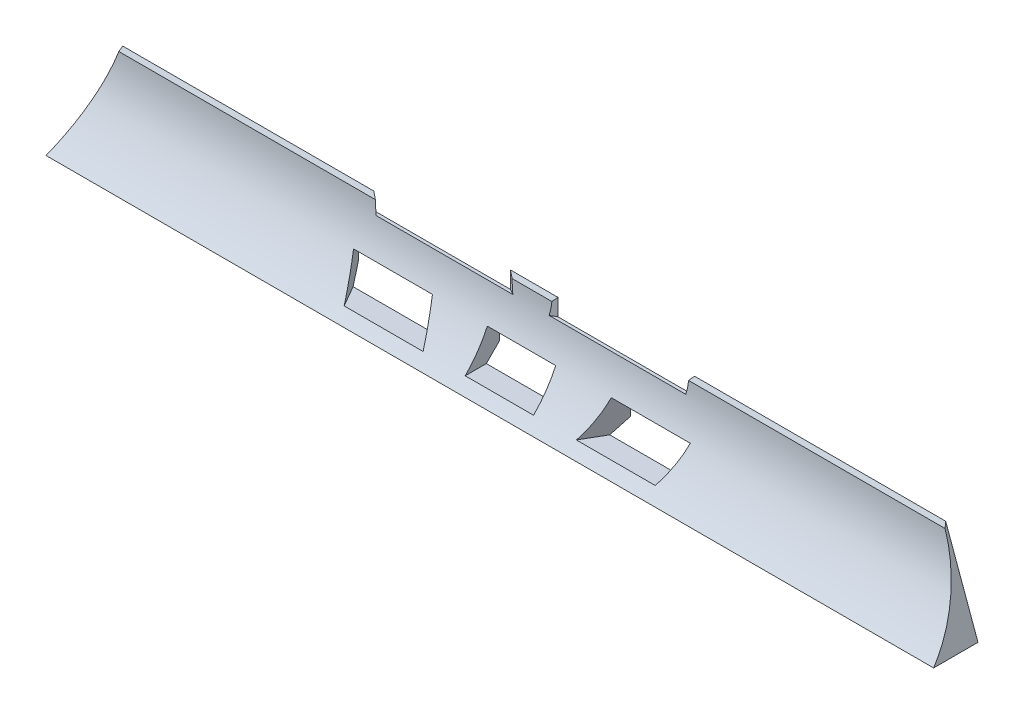
from build123d import *

# Parameters (mm, degrees)
BOSS_EXTRUDE1_DEPTH = 200
CUT_EXTRUDE1_DEPTH  = 202.246117975
CUT_EXTRUDE2_DEPTH  = 202.246117975
BOSS_EXTRUDE2_REACH = 203.246
SKETCH5_W           = 3
SKETCH5_H           = 5
CUT_EXTRUDE3_DEPTH  = 202.246117975
BOSS_EXTRUDE3_REACH = 203.246
SKETCH7_W           = 8
SKETCH7_H           = 11
CUT_EXTRUDE4_DEPTH  = 1.8
SKETCH9_W           = 15.4
SKETCH9_H           = 7.2
CUT_EXTRUDE6_DEPTH  = 202.246117975
CUT_EXTRUDE8_START  = -6.8
SKETCH10_W          = 15.4
SKETCH10_H          = 7.2
CUT_EXTRUDE8_DEPTH  = 22.6
SKETCH11_W          = 15.4
SKETCH11_H          = 8.8
CUT_EXTRUDE9_DEPTH  = 97.8


with BuildPart() as part:
    # Sketch1 → Boss-Extrude1 (new body)
    with BuildSketch(Plane(origin=(0, 0, 0), x_dir=(0, 0, -1), z_dir=(1, 0, 0))):
        Polygon((0, 0), (-10, 0), (0, 20), align=None)
    extrude(amount=BOSS_EXTRUDE1_DEPTH)

    # Sketch2 → Cut-Extrude1 (cut, through all)
    with BuildSketch(Plane(origin=(200, 0, 0), x_dir=(0, 0, -1), z_dir=(1, 0, 0))):
        with BuildLine():
            Line((-10, 0), (-0.5, 19))
            ThreePointArc((-0.5, 19), (-3.131602705, 8.440801352), (-10, 0))
        make_face()
    extrude(amount=-CUT_EXTRUDE1_DEPTH, mode=Mode.SUBTRACT)

    # Sketch4 → Cut-Extrude2 (cut, through all)
    with BuildSketch(Plane(origin=(200, 0, 0), x_dir=(0, 0, -1), z_dir=(1, 0, 0))):
        Polygon((-5, 0), (0, 5), (0, 0), align=None)
    extrude(amount=-CUT_EXTRUDE2_DEPTH, mode=Mode.SUBTRACT)

    # Boss-Extrude2: up to this face of the body (flat: up to its plane)
    boss_extrude2_end = Plane(part.part.faces().sort_by_distance((100, 2.5, 2.5))[0])
    # Sketch5 → Boss-Extrude2 (add, up to the picked face)
    with BuildSketch(Plane(origin=(0, 0, 0), x_dir=(-1, 0, 0), z_dir=(0, 0, -1)), mode=Mode.PRIVATE) as boss_extrude2_sk1:
        with Locations((-198.5, 2.5)):
            Rectangle(SKETCH5_W, SKETCH5_H)
    boss_extrude2_tool1 = split(extrude(boss_extrude2_sk1.sketch, amount=-BOSS_EXTRUDE2_REACH, mode=Mode.PRIVATE), bisect_by=boss_extrude2_end, keep=Keep.BOTH, mode=Mode.PRIVATE)
    boss_extrude2 = boss_extrude2_tool1.solids().sort_by(Axis((198.5, 2.5, 0), (0, 0, 1)))[0]
    add(boss_extrude2)

    # Sketch6 → Cut-Extrude3 (cut, through all)
    with BuildSketch(Plane(origin=(0, 0, 0), x_dir=(-1, 0, 0), z_dir=(0, 0, -1))):
        Polygon((-200, 20), (-192.720595315, 20), (-200, 0), align=None)
    cut_extrude3 = extrude(amount=-CUT_EXTRUDE3_DEPTH, mode=Mode.SUBTRACT)

    # Mirror2: Boss-Extrude2, Cut-Extrude3 across plane
    add(boss_extrude2.mirror(Plane(origin=(100, 0, 0), x_dir=(0, 0, 1), z_dir=(1, 0, 0))))
    add(cut_extrude3.mirror(Plane(origin=(100, 0, 0), x_dir=(0, 0, 1), z_dir=(1, 0, 0))), mode=Mode.SUBTRACT)

    # Sketch7 → Boss-Extrude3 (add, up to next)
    with BuildSketch(Plane(origin=(0, 0, 0), x_dir=(-1, 0, 0), z_dir=(0, 0, -1)), mode=Mode.PRIVATE) as boss_extrude3_sk1:
        with Locations((-163.831600122, 5.5)):
            Rectangle(SKETCH7_W, SKETCH7_H)
    boss_extrude3_tool1 = extrude(boss_extrude3_sk1.sketch, amount=-BOSS_EXTRUDE3_REACH, mode=Mode.PRIVATE) - part.part
    boss_extrude3 = boss_extrude3_tool1.solids().sort_by_distance((163.8316, 5.5, 0))[0]
    add(boss_extrude3)

    # Sketch8 → Cut-Extrude4 (cut)
    with BuildSketch(Plane(origin=(0, 0, 0), x_dir=(-1, 0, 0), z_dir=(0, 0, -1))):
        Polygon((-162.099549314, 8.5), (-165.56365093, 8.5), (-167.295701737, 5.5), (-165.56365093, 2.5), (-162.099549314, 2.5), (-160.367498507, 5.5), align=None)
    cut_extrude4 = extrude(amount=-CUT_EXTRUDE4_DEPTH, mode=Mode.SUBTRACT)

    # Mirror3: Boss-Extrude3, Cut-Extrude4 across plane
    add(boss_extrude3.mirror(Plane(origin=(100, 0, 0), x_dir=(0, 0, 1), z_dir=(1, 0, 0))))
    add(cut_extrude4.mirror(Plane(origin=(100, 0, 0), x_dir=(0, 0, 1), z_dir=(1, 0, 0))), mode=Mode.SUBTRACT)

    # Sketch9 → Cut-Extrude6 (cut, through all)
    with BuildSketch(Plane.XY):
        with Locations((99.915800061, 5.6)):
            Rectangle(SKETCH9_W, SKETCH9_H)
    extrude(amount=CUT_EXTRUDE6_DEPTH, mode=Mode.SUBTRACT)

    # Sketch10 → Cut-Extrude8 (cut)
    with BuildSketch(Plane(origin=(32.136000823, 0, -55.661186177), x_dir=(0.866025403784433, 0, 0.5000000000000099), z_dir=(-0.5000000000000098, 0, 0.8660254037844329)).offset(CUT_EXTRUDE8_START)):
        with Locations((113.139032853, 5.6)):
            Rectangle(SKETCH10_W, SKETCH10_H)
    cut_extrude8 = extrude(amount=CUT_EXTRUDE8_DEPTH, mode=Mode.SUBTRACT)

    # Sketch11 → Cut-Extrude9 (cut)
    with BuildSketch(Plane(origin=(115.669713788, 0, -66.781940393), x_dir=(0.4999999999999981, -1.9080601945838373e-15, 0.8660254037844397), z_dir=(-0.8660254037844397, 3.3048572009189827e-15, 0.4999999999999981))):
        with Locations((60.371690641, 20.6)):
            Rectangle(SKETCH11_W, SKETCH11_H)
    cut_extrude9 = extrude(amount=CUT_EXTRUDE9_DEPTH, mode=Mode.SUBTRACT)

    # Mirror4: Cut-Extrude8, Cut-Extrude9 across plane
    add(cut_extrude8.mirror(Plane(origin=(100, 0, 0), x_dir=(0, 0, 1), z_dir=(1, 0, 0))), mode=Mode.SUBTRACT)
    add(cut_extrude9.mirror(Plane(origin=(100, 0, 0), x_dir=(0, 0, 1), z_dir=(1, 0, 0))), mode=Mode.SUBTRACT)


solid = part.part
